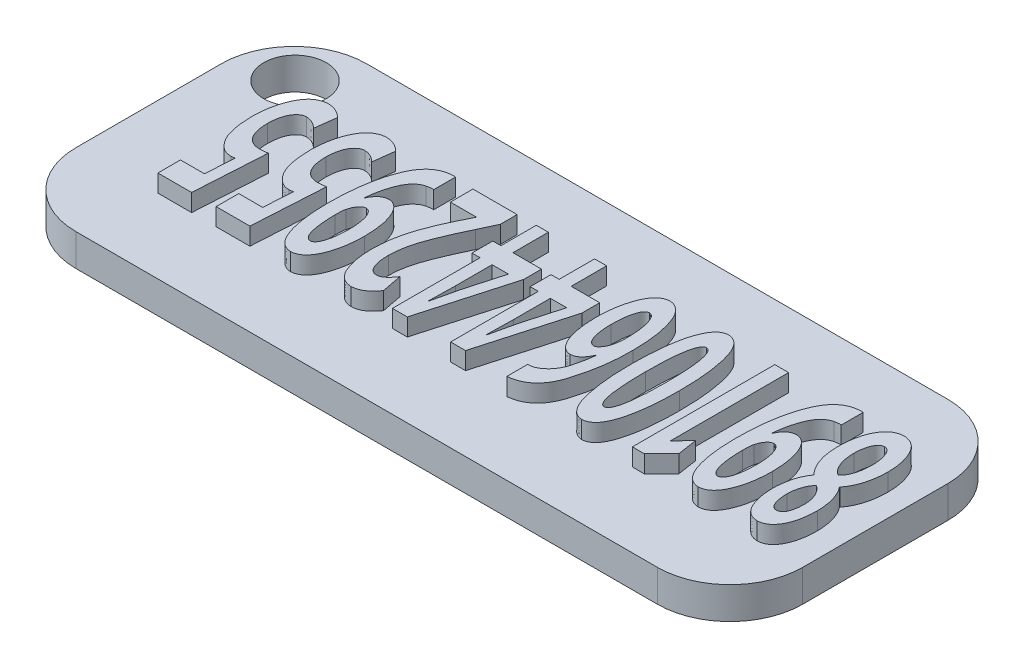
from build123d import *

# Parameters (mm, degrees)
SKETCH_1_W          = 50
SKETCH_1_H          = 20
EXTRUDE_1_DEPTH     = 2.2
FILLET_1_R          = 5
FILLET_2_R          = 5
FILLET_3_R          = 5
FILLET_4_R          = 5
SKETCH_4_R          = 2.151855383
CUT_EXTRUDE_1_DEPTH = 3
EXTRUDE_START       = -1.2
EXTRUDE_1058_DEPTH  = 1.2


# Read off the part's stored shape, not the designer's step: надпись
with BuildPart() as part:
    # Эскиз1 → Бобышка-Вытянуть1 (new body)
    with BuildSketch(Plane(origin=(0, 0, 0), x_dir=(1, 0, 0), z_dir=(0, 1, 0))):
        with Locations((25, 10)):
            Rectangle(SKETCH_1_W, SKETCH_1_H)
    extrude(amount=EXTRUDE_1_DEPTH)

    # Скругление1
    fillet_1_edges = [part.edges().sort_by_distance(p)[0] for p in [
        (0, 1.1, -20),
    ]]
    fillet(fillet_1_edges, radius=FILLET_1_R)

    # Скругление2
    fillet_2_edges = [part.edges().sort_by_distance(p)[0] for p in [
        (0, 1.1, 0),
    ]]
    fillet(fillet_2_edges, radius=FILLET_2_R)

    # Скругление3
    fillet_3_edges = [part.edges().sort_by_distance(p)[0] for p in [
        (50, 1.1, -20),
    ]]
    fillet(fillet_3_edges, radius=FILLET_3_R)

    # Скругление4
    fillet_4_edges = [part.edges().sort_by_distance(p)[0] for p in [
        (50, 1.1, 0),
    ]]
    fillet(fillet_4_edges, radius=FILLET_4_R)

    # Эскиз4 → Вырез-Вытянуть1 (cut)
    with BuildSketch(Plane(origin=(0, 2.2, 0), x_dir=(1, 0, 0), z_dir=(0, 1, 0))):
        with Locations(Location((3.542470198, 16.528352227, 0), (0, 0, 270))):
            Circle(SKETCH_4_R)
    extrude(amount=-CUT_EXTRUDE_1_DEPTH, mode=Mode.SUBTRACT)

    # Extrude 1058 outline → Extrude 1058 (add)
    # profile 1 of 11: a face of its own
    with BuildSketch(Plane.XZ.offset(-2.2).offset(EXTRUDE_START)):
        with BuildLine():
            add(Edge.make_bspline(
                [(46.078309947, -9.677843866), (46.027974113, -9.605172508), (45.925734825, -9.457566573), (45.797719515, -9.21403545), (45.690766361, -8.949790128), (45.605330166, -8.667262078), (45.538818282, -8.374682095), (45.489532793, -8.076942657), (45.45786786, -7.777208198), (45.454564992, -7.576119586), (45.452912137, -7.475488811)],
                knots=[0, 0, 0, 0, 0.113941103, 0.2314307, 0.353960198, 0.481139313, 0.611706454, 0.740704099, 0.870240551, 1, 1, 1, 1], degree=3))
            Line((46.078309947, -9.677843866), (46.078854937, -9.703996008))
            add(Edge.make_bspline(
                [(45.211584793, -12.207767208), (45.21631399, -12.061200702), (45.225433942, -11.778556663), (45.273766155, -11.372768263), (45.352120596, -11.002667897), (45.459635252, -10.669550107), (45.589719445, -10.373513923), (45.734618791, -10.113421233), (45.894005329, -9.888382936), (46.01865144, -9.764048816), (46.078854937, -9.703996008)],
                knots=[0, 0, 0, 0, 0.161686258, 0.311801503, 0.450067459, 0.578302134, 0.697174596, 0.806108895, 0.906351489, 1, 1, 1, 1], degree=3))
            add(Edge.make_bspline(
                [(46.863168807, -15.113122193), (46.80262288, -15.109171079), (46.684044908, -15.101432903), (46.511067483, -15.060678112), (46.347933835, -14.995360647), (46.191896755, -14.909032346), (46.047301537, -14.794897335), (45.911617757, -14.658556004), (45.784541788, -14.498597289), (45.668579213, -14.315558168), (45.563753042, -14.112223731), (45.470997983, -13.891170782), (45.394091896, -13.651866208), (45.330756558, -13.395988548), (45.279593831, -13.122797621), (45.242938773, -12.833195306), (45.217255905, -12.526213109), (45.213510802, -12.315917003), (45.211584793, -12.207767208)],
                knots=[0, 0, 0, 0, 0.04935732, 0.096665312, 0.144003759, 0.192132698, 0.241383724, 0.293506514, 0.348508342, 0.407438452, 0.469713062, 0.534644972, 0.602472394, 0.674232576, 0.749229871, 0.828723586, 0.911917015, 1, 1, 1, 1], degree=3))
            add(Edge.make_bspline(
                [(48.454420985, -12.428355484), (48.452674256, -12.516993812), (48.449226519, -12.691950305), (48.430923326, -12.949468758), (48.398000408, -13.197850059), (48.355874941, -13.436766086), (48.298960072, -13.665970943), (48.22900655, -13.885768002), (48.146139953, -14.095954879), (48.053448211, -14.295680741), (47.946991827, -14.478130498), (47.827908731, -14.639709615), (47.697781171, -14.778860945), (47.554387512, -14.893967333), (47.398514091, -14.984872048), (47.231251794, -15.053623861), (47.051286399, -15.097807415), (46.926883157, -15.107935165), (46.863168807, -15.113122193)],
                knots=[0, 0, 0, 0, 0.077214743, 0.152408342, 0.224719305, 0.295370231, 0.363611314, 0.430261871, 0.496132333, 0.560288229, 0.621875218, 0.679791288, 0.734777273, 0.787353525, 0.839365363, 0.891411757, 0.944385459, 1, 1, 1, 1], degree=3))
            add(Edge.make_bspline(
                [(47.695145343, -9.85936227), (47.747554237, -9.926459085), (47.856031089, -10.065337253), (47.992318934, -10.306361212), (48.120543883, -10.577558027), (48.235291236, -10.883599416), (48.332007715, -11.222904393), (48.400135986, -11.596003837), (48.444033938, -12.001236193), (48.450872319, -12.282433004), (48.454420985, -12.428355484)],
                knots=[0, 0, 0, 0, 0.093486626, 0.193500263, 0.303527542, 0.423128014, 0.552388557, 0.690879033, 0.839586736, 1, 1, 1, 1], degree=3))
            Line((47.695145343, -9.85936227), (47.696502294, -9.820888941))
            add(Edge.make_bspline(
                [(48.333757313, -7.669681908), (48.332400882, -7.773485108), (48.329714157, -7.979091408), (48.294470298, -8.282880004), (48.248183965, -8.579721921), (48.175551215, -8.86483122), (48.087174996, -9.135586497), (47.976756913, -9.385857701), (47.850277624, -9.616246555), (47.747160445, -9.753473674), (47.696502294, -9.820888941)],
                knots=[0, 0, 0, 0, 0.136247325, 0.26986941, 0.401216199, 0.530532356, 0.655813574, 0.774814705, 0.889373711, 1, 1, 1, 1], degree=3))
            add(Edge.make_bspline(
                [(46.853741958, -5.003768899), (46.90797993, -5.007260305), (47.014463515, -5.014114866), (47.169787234, -5.050784431), (47.315929588, -5.110360712), (47.455258419, -5.189599), (47.583778459, -5.293674812), (47.705715522, -5.417268753), (47.817999658, -5.563759963), (47.924291395, -5.729516874), (48.016616167, -5.916192509), (48.100737096, -6.118543686), (48.169034399, -6.33794704), (48.228390088, -6.572481678), (48.272394452, -6.824061429), (48.306605506, -7.091379936), (48.326940882, -7.375267295), (48.331443098, -7.569726588), (48.333757313, -7.669681908)],
                knots=[0, 0, 0, 0, 0.048503693, 0.095225668, 0.141839522, 0.189135082, 0.237898156, 0.289124475, 0.343943217, 0.402519234, 0.464803107, 0.529773363, 0.598149215, 0.669927247, 0.745822609, 0.826203937, 0.910665924, 1, 1, 1, 1], degree=3))
            add(Edge.make_bspline(
                [(45.452912137, -7.475488811), (45.456739433, -7.319432744), (45.464194853, -7.015441717), (45.526511786, -6.573878797), (45.63311746, -6.161319712), (45.753938359, -5.83962289), (45.873267915, -5.604845892), (45.977498211, -5.452969286), (46.093544961, -5.323103196), (46.221115754, -5.213766333), (46.361470193, -5.126354365), (46.514657083, -5.061353085), (46.680172404, -5.019646003), (46.795068916, -5.009135957), (46.853741958, -5.003768899)],
                knots=[0, 0, 0, 0, 0.14929621, 0.290823096, 0.425604597, 0.556392853, 0.618800505, 0.677186811, 0.732126157, 0.785029691, 0.837431757, 0.889709436, 0.943679032, 1, 1, 1, 1], degree=3))
        make_face()
        with BuildLine():
            add(Edge.make_bspline(
                [(46.161811212, -12.362367538), (46.163759344, -12.457382745), (46.167514338, -12.640523049), (46.202428312, -12.9042703), (46.256201504, -13.146406235), (46.3292193, -13.363319376), (46.421100573, -13.54734881), (46.538282039, -13.686539035), (46.679667922, -13.777266891), (46.784568197, -13.793060782), (46.836544836, -13.80087038)],
                knots=[0, 0, 0, 0, 0.165153543, 0.318330835, 0.461763472, 0.595861741, 0.715629486, 0.817101713, 0.909318156, 0.99986714, 0.99986714, 0.99986714, 0.99986714], degree=3))
            add(Edge.make_bspline(
                [(46.914073794, -10.509048947), (46.86044007, -10.548203883), (46.750645538, -10.628358636), (46.609486585, -10.785243872), (46.482183681, -10.970250236), (46.371339819, -11.186804007), (46.277961057, -11.434662914), (46.214225457, -11.716286991), (46.172416068, -12.028695365), (46.165451114, -12.247841318), (46.161811212, -12.362367538)],
                knots=[0, 0, 0, 0, 0.095604842, 0.195714339, 0.302624958, 0.419033209, 0.545871774, 0.683790463, 0.83474811, 1, 1, 1, 1], degree=3))
            add(Edge.make_bspline(
                [(47.504194566, -12.245474606), (47.501605234, -12.149267424), (47.496550758, -11.961467335), (47.469393374, -11.687559734), (47.419429409, -11.430678791), (47.355280098, -11.191444527), (47.271814748, -10.975113826), (47.170826099, -10.787544871), (47.053714874, -10.629827493), (46.959591571, -10.548418242), (46.914073794, -10.509048947)],
                knots=[0, 0, 0, 0, 0.152677995, 0.29803327, 0.436098728, 0.567455095, 0.690591438, 0.803037348, 0.90474939, 1, 1, 1, 1], degree=3))
            add(Edge.make_bspline(
                [(46.836544836, -13.80087038), (46.86261082, -13.798162612), (46.913863854, -13.792811886), (46.987088364, -13.766571208), (47.056547102, -13.729238508), (47.117966898, -13.673680896), (47.180206287, -13.610280654), (47.232947149, -13.529565327), (47.285573124, -13.438614817), (47.344553499, -13.294330749), (47.410925257, -13.095175517), (47.463520234, -12.833038866), (47.498548764, -12.547453652), (47.502265453, -12.348657789), (47.504194566, -12.245474606)],
                knots=[0.000181514, 0.000181514, 0.000181514, 0.000181514, 0.043073183, 0.084527609, 0.127035215, 0.1717059, 0.219898678, 0.272580112, 0.329424805, 0.392311346, 0.528096431, 0.673647876, 0.8306099, 1, 1, 1, 1], degree=3))
        make_face(mode=Mode.SUBTRACT)
        with BuildLine():
            add(Edge.make_bspline(
                [(47.504194566, -7.579184154), (47.503195757, -7.499277873), (47.501255068, -7.344019773), (47.473234473, -7.117775601), (47.431519103, -6.903753043), (47.369090488, -6.707727668), (47.290569229, -6.53547269), (47.182295761, -6.403004689), (47.043184988, -6.318466445), (46.940284878, -6.303102084), (46.887678615, -6.295247266)],
                knots=[0, 0, 0, 0, 0.153851589, 0.298934016, 0.438563176, 0.573351932, 0.694652626, 0.801164328, 0.898348004, 1, 1, 1, 1], degree=3))
            add(Edge.make_bspline(
                [(46.81226382, -9.134614305), (46.862439152, -9.096350175), (46.963589503, -9.019212066), (47.096313583, -8.876918569), (47.213065342, -8.713564267), (47.315895318, -8.52958974), (47.398878962, -8.323302575), (47.458545593, -8.094677067), (47.497098, -7.844424879), (47.501769248, -7.669832657), (47.504194566, -7.579184154)],
                knots=[0, 0, 0, 0, 0.106825906, 0.215354388, 0.328311063, 0.44659403, 0.571831886, 0.704152423, 0.846395563, 1, 1, 1, 1], degree=3))
            add(Edge.make_bspline(
                [(46.282474884, -7.64328673), (46.285542594, -7.725718472), (46.291533991, -7.886711995), (46.322755467, -8.121747951), (46.368092179, -8.344452345), (46.434989814, -8.55067455), (46.511234044, -8.737323134), (46.60109943, -8.897440638), (46.696643827, -9.032946341), (46.775094048, -9.101929862), (46.81226382, -9.134614305)],
                knots=[0, 0, 0, 0, 0.152064887, 0.296990713, 0.436806136, 0.570611067, 0.696334438, 0.80790798, 0.908986661, 1, 1, 1, 1], degree=3))
            add(Edge.make_bspline(
                [(46.886500259, -6.293647279), (46.83538083, -6.301938363), (46.734376801, -6.318320253), (46.600140532, -6.408312885), (46.493740845, -6.543789202), (46.41679896, -6.722317663), (46.358261152, -6.92709015), (46.311903706, -7.152013712), (46.285864996, -7.392535246), (46.283622758, -7.558383626), (46.282474884, -7.64328673)],
                knots=[0, 0, 0, 0, 0.095691051, 0.189070611, 0.29330398, 0.413483092, 0.549311339, 0.690551989, 0.841583641, 1, 1, 1, 1], degree=3))
            Line((46.886500259, -6.293647279), (46.887678615, -6.295247266))
        make_face(mode=Mode.SUBTRACT)
    # profile 2 of 11: a face of its own
    with BuildSketch(Plane.XZ.offset(-2.2).offset(EXTRUDE_START)):
        with BuildLine():
            add(Edge.make_bspline(
                [(44.04725437, -15.11174683), (43.987385205, -15.114070393), (43.868898808, -15.118668932), (43.693434551, -15.103937408), (43.523252435, -15.077828695), (43.358741609, -15.039003764), (43.201388033, -14.983318238), (43.050111553, -14.915129471), (42.903936107, -14.834674512), (42.766996185, -14.736787277), (42.632629914, -14.629426485), (42.508059907, -14.504726533), (42.38788946, -14.367318384), (42.273368197, -14.217136563), (42.16508345, -14.052358087), (42.066568067, -13.872002181), (41.96939987, -13.68052939), (41.851289199, -13.402249017), (41.717343953, -13.031760823), (41.577455337, -12.561667209), (41.462107324, -12.061386408), (41.365507994, -11.533031322), (41.293318956, -10.975995836), (41.240314731, -10.390514117), (41.210397464, -9.775330417), (41.207191415, -9.35523444), (41.205550872, -9.140270414)],
                knots=[0, 0, 0, 0, 0.024487623, 0.048463181, 0.07187814, 0.09488595, 0.117488049, 0.140040387, 0.162712552, 0.185605178, 0.208811761, 0.232989069, 0.257583726, 0.28344624, 0.310184461, 0.338150104, 0.367466745, 0.397981826, 0.461741489, 0.528520028, 0.598484453, 0.671649595, 0.748146436, 0.828163951, 0.91207112, 1, 1, 1, 1], degree=3))
            Line((44.04725437, -15.11174683), (44.048688651, -13.601055549))
            add(Edge.make_bspline(
                [(43.579231551, -13.561462782), (43.61258245, -13.566861786), (43.67367764, -13.576752169), (43.756732427, -13.593836438), (43.824452891, -13.601489775), (43.891708091, -13.613413366), (43.965642464, -13.61504435), (44.021131507, -13.605697441), (44.048688651, -13.601055549)],
                knots=[0, 0, 0, 0, 0.213719524, 0.39151073, 0.53600369, 0.644514602, 0.823457719, 1, 1, 1, 1], degree=3))
            add(Edge.make_bspline(
                [(42.143203863, -10.732850085), (42.152913081, -10.826145832), (42.171961613, -11.009182943), (42.213021068, -11.276889607), (42.256329034, -11.533427069), (42.312327657, -11.777714281), (42.373431464, -12.010753199), (42.443989973, -12.232601603), (42.520328195, -12.443143418), (42.604992277, -12.640929958), (42.696024941, -12.824197987), (42.797560211, -12.98838531), (42.907535712, -13.132919259), (43.024857499, -13.258958894), (43.151200313, -13.365300223), (43.286637025, -13.450625789), (43.428878747, -13.518420365), (43.529094466, -13.547109732), (43.579231551, -13.561462782)],
                knots=[0, 0, 0, 0, 0.083749371, 0.164308055, 0.241812066, 0.316015091, 0.388027431, 0.456894199, 0.523829033, 0.58793985, 0.648928779, 0.706394687, 0.760048322, 0.810868126, 0.859873756, 0.907048861, 0.953497323, 1, 1, 1, 1], degree=3))
            Line((42.143203863, -10.732850085), (42.163318771, -10.720210373))
            add(Edge.make_bspline(
                [(43.094691492, -11.489441284), (43.044787182, -11.486183321), (42.945933546, -11.479729739), (42.803226891, -11.439100379), (42.670705849, -11.373559165), (42.548260623, -11.283451948), (42.439085027, -11.168339541), (42.333351592, -11.038338918), (42.241947327, -10.886319281), (42.190018525, -10.776615668), (42.163318771, -10.720210373)],
                knots=[0, 0, 0, 0, 0.116925784, 0.23161404, 0.344884987, 0.461810772, 0.58572325, 0.71565789, 0.85380244, 1, 1, 1, 1], degree=3))
            add(Edge.make_bspline(
                [(44.446501695, -8.465307997), (44.444301581, -8.579725962), (44.440018776, -8.802455229), (44.418138685, -9.126841338), (44.389744776, -9.432845618), (44.346232134, -9.719112434), (44.291514129, -9.986576149), (44.226515668, -10.234971415), (44.149036141, -10.464286834), (44.061521886, -10.673296099), (43.963022591, -10.859813171), (43.86081538, -11.024451663), (43.750302846, -11.165118524), (43.632325733, -11.27981019), (43.50792487, -11.371672429), (43.375998762, -11.435440305), (43.238321206, -11.480471442), (43.142806007, -11.486436477), (43.094691492, -11.489441284)],
                knots=[0, 0, 0, 0, 0.095610673, 0.186118458, 0.27160428, 0.352333468, 0.42792741, 0.499640582, 0.56673059, 0.630030627, 0.688754273, 0.74280495, 0.791766595, 0.837817092, 0.879939355, 0.920333827, 0.959869222, 1, 1, 1, 1], degree=3))
            add(Edge.make_bspline(
                [(42.81188601, -4.994342049), (42.873943174, -5.000099892), (42.997342197, -5.011549209), (43.174435585, -5.071753842), (43.341841896, -5.156147597), (43.497681637, -5.27312241), (43.642287555, -5.41903082), (43.776639778, -5.595135643), (43.901300582, -5.799757373), (44.011533243, -6.03278609), (44.113476948, -6.28555358), (44.198583084, -6.556030295), (44.274785722, -6.839444532), (44.337084136, -7.137093239), (44.382818759, -7.449561619), (44.419726254, -7.775163248), (44.439445614, -8.115654083), (44.444116993, -8.347137517), (44.446501695, -8.465307997)],
                knots=[0, 0, 0, 0, 0.044788294, 0.089060333, 0.133839461, 0.179508177, 0.228843309, 0.281493248, 0.338836435, 0.401246252, 0.467120147, 0.535176432, 0.605509425, 0.678636709, 0.754243913, 0.833093643, 0.914795611, 1, 1, 1, 1], degree=3))
            add(Edge.make_bspline(
                [(41.205550872, -9.140270414), (41.207264897, -8.991309733), (41.210614758, -8.700183418), (41.228928778, -8.27442403), (41.26139615, -7.870179001), (41.303851059, -7.487012124), (41.35985007, -7.12516581), (41.429753321, -6.785560877), (41.510350616, -6.467461477), (41.603134364, -6.172814895), (41.708826173, -5.906123561), (41.827749924, -5.671195277), (41.958955197, -5.470530026), (42.102547312, -5.302101472), (42.26283362, -5.173038944), (42.433532632, -5.075831142), (42.618009403, -5.01296775), (42.746684608, -5.000605939), (42.81188601, -4.994342049)],
                knots=[0, 0, 0, 0, 0.093043437, 0.181842568, 0.266109144, 0.34630305, 0.422583728, 0.494716837, 0.562788119, 0.627465506, 0.6875281, 0.741774322, 0.791636758, 0.836982325, 0.879404895, 0.919475901, 0.959197391, 1, 1, 1, 1], degree=3))
        make_face()
        with BuildLine():
            add(Edge.make_bspline(
                [(43.501931386, -8.291853969), (43.499172297, -8.153522521), (43.493908565, -7.889616713), (43.460775977, -7.513375446), (43.405536667, -7.177101272), (43.340129957, -6.924955276), (43.279157951, -6.746836863), (43.227842301, -6.634724435), (43.176350338, -6.536377609), (43.117340877, -6.457508469), (43.056964627, -6.392355076), (42.99033886, -6.347000991), (42.91982955, -6.316280085), (42.870621648, -6.309816763), (42.845822668, -6.306559485)],
                knots=[0, 0, 0, 0, 0.187002657, 0.356759712, 0.510118111, 0.647153892, 0.708418131, 0.764316503, 0.813745831, 0.85809532, 0.897148384, 0.933203113, 0.966336816, 1, 1, 1, 1], degree=3))
            add(Edge.make_bspline(
                [(42.832625079, -10.186650697), (42.857327254, -10.184568066), (42.906667609, -10.1804082), (42.978465354, -10.154699735), (43.044277372, -10.112341419), (43.106396021, -10.054870548), (43.165721311, -9.984224083), (43.221107135, -9.897287482), (43.271162554, -9.795137333), (43.33631677, -9.632755834), (43.402506594, -9.394999705), (43.459803499, -9.070602549), (43.494534602, -8.697313717), (43.499373301, -8.432077134), (43.501931386, -8.291853969)],
                knots=[0, 0, 0, 0, 0.03448244, 0.068875547, 0.105130244, 0.143003502, 0.186571321, 0.233520861, 0.286467941, 0.345095043, 0.477485255, 0.629894425, 0.804335531, 1, 1, 1, 1], degree=3))
            add(Edge.make_bspline(
                [(42.208567648, -9.430617376), (42.238302449, -9.525684566), (42.295931093, -9.709933092), (42.4157911, -9.915830309), (42.528538944, -10.050337156), (42.621005158, -10.125337554), (42.723563966, -10.173398169), (42.796336215, -10.182241067), (42.832625079, -10.186650697)],
                knots=[0, 0, 0, 0, 0.286215616, 0.554710882, 0.6791684, 0.78996751, 0.895264466, 1, 1, 1, 1], degree=3))
            add(Edge.make_bspline(
                [(42.155777292, -8.702864602), (42.155368544, -8.74812072), (42.154596287, -8.833624136), (42.15968612, -8.954239716), (42.162435199, -9.060539025), (42.170279424, -9.177455748), (42.179085395, -9.300512339), (42.199485933, -9.390539813), (42.208567648, -9.430617376)],
                knots=[0, 0, 0, 0, 0.185634103, 0.350722746, 0.495196877, 0.621767754, 0.831622217, 1, 1, 1, 1], degree=3))
            add(Edge.make_bspline(
                [(42.844590917, -6.304677798), (42.81632972, -6.308919917), (42.759015095, -6.317523072), (42.678836933, -6.357293238), (42.605990003, -6.416423603), (42.536602226, -6.493216758), (42.476050485, -6.592472346), (42.419178939, -6.710531156), (42.368846462, -6.849011498), (42.308227289, -7.066665145), (42.244553984, -7.373100249), (42.194071408, -7.777220869), (42.161821034, -8.225345058), (42.15785408, -8.538776352), (42.155777292, -8.702864602)],
                knots=[0, 0, 0, 0, 0.032360413, 0.065627968, 0.100251475, 0.138736479, 0.182780166, 0.232036785, 0.287698539, 0.350174283, 0.489029732, 0.64337453, 0.813298638, 1, 1, 1, 1], degree=3))
            Line((42.844590917, -6.304677798), (42.845822668, -6.306559485))
        make_face(mode=Mode.SUBTRACT)
    # profile 3 of 11: a face of its own
    with BuildSketch(Plane.XZ.offset(-2.2).offset(EXTRUDE_START)):
        with BuildLine():
            add(Edge.make_bspline(
                [(34.821367358, -15.101809973), (34.758371034, -15.09638161), (34.631985738, -15.085491049), (34.449405767, -15.01868558), (34.28025536, -14.908811333), (34.122442761, -14.759422894), (33.980242568, -14.566701686), (33.845874104, -14.33684957), (33.724835618, -14.065712383), (33.614862883, -13.755863084), (33.514803262, -13.409193068), (33.432270523, -13.025732465), (33.358172661, -12.608293788), (33.298933813, -12.15591364), (33.25204862, -11.66856733), (33.218888626, -11.146674152), (33.197866733, -10.589663148), (33.194974053, -10.206781024), (33.193483032, -10.009425929)],
                knots=[0, 0, 0, 0, 0.033109461, 0.06642529, 0.100865822, 0.138473422, 0.179945314, 0.226267604, 0.2781327, 0.335680383, 0.398904279, 0.467558637, 0.541656706, 0.621602041, 0.707188389, 0.798842127, 0.89631396, 1, 1, 1, 1], degree=3))
            Line((34.821367358, -15.101809973), (34.822442608, -15.101809973))
            add(Edge.make_bspline(
                [(36.436319225, -10.086726094), (36.436083751, -10.25831122), (36.435622164, -10.594660491), (36.417659208, -11.088138692), (36.390245954, -11.560997764), (36.349298648, -12.012552367), (36.294094971, -12.443776648), (36.228810149, -12.853881675), (36.151934451, -13.243461663), (36.062823732, -13.608118868), (35.962538815, -13.942186433), (35.843466511, -14.236088467), (35.713149094, -14.489470684), (35.566009461, -14.700168368), (35.40286528, -14.867821763), (35.223889879, -14.991663615), (35.029518106, -15.075757432), (34.891730566, -15.093092731), (34.822442608, -15.101809973)],
                knots=[0, 0, 0, 0, 0.091547972, 0.179456661, 0.263440314, 0.344257307, 0.421328872, 0.495367316, 0.565800515, 0.633142072, 0.695615521, 0.751721211, 0.802120328, 0.847339139, 0.888360757, 0.926217596, 0.962897719, 1, 1, 1, 1], degree=3))
            add(Edge.make_bspline(
                [(34.79039132, -5.005654268), (34.857736276, -5.012484701), (34.991926218, -5.026094857), (35.182790125, -5.105203556), (35.360628892, -5.221532839), (35.522537416, -5.383463747), (35.671462474, -5.584916244), (35.803880809, -5.829877383), (35.926696152, -6.114231056), (36.033529463, -6.439779921), (36.128218001, -6.799585126), (36.210068103, -7.188714477), (36.282880803, -7.604092372), (36.337426869, -8.047913084), (36.383192211, -8.5187241), (36.41450535, -9.017369504), (36.433689263, -9.54295639), (36.435428552, -9.902570919), (36.436319225, -10.086726094)],
                knots=[0, 0, 0, 0, 0.035432365, 0.07060168, 0.107362668, 0.146629638, 0.190325044, 0.238704697, 0.292737959, 0.353046496, 0.418707631, 0.488331289, 0.562123203, 0.640426583, 0.723437346, 0.810876272, 0.903151541, 1, 1, 1, 1], degree=3))
            add(Edge.make_bspline(
                [(33.193483032, -10.009425929), (33.193662643, -9.83846625), (33.194014697, -9.503367638), (33.212780558, -9.011224948), (33.237450067, -8.539569403), (33.276986168, -8.08868405), (33.329736307, -7.659276576), (33.393699665, -7.250492679), (33.469164864, -6.862499825), (33.553004984, -6.497128173), (33.653235104, -6.164136588), (33.766206659, -5.869060173), (33.898439487, -5.617603335), (34.045022424, -5.408078929), (34.206395895, -5.238370761), (34.386881045, -5.116430621), (34.581925939, -5.031316429), (34.720434049, -5.014266033), (34.79039132, -5.005654268)],
                knots=[0, 0, 0, 0, 0.091423284, 0.17919907, 0.263357202, 0.343996012, 0.421203867, 0.494696639, 0.565227649, 0.632567207, 0.695086524, 0.751072127, 0.801290447, 0.84661368, 0.887494442, 0.925716055, 0.962480882, 1, 1, 1, 1], degree=3))
        make_face()
        with BuildLine():
            add(Edge.make_bspline(
                [(34.143709452, -10.047133326), (34.143696262, -10.186029654), (34.143670654, -10.455688364), (34.154171592, -10.847230506), (34.167314759, -11.21300133), (34.182722741, -11.553232374), (34.20827292, -11.867383211), (34.235658748, -12.156693129), (34.268989574, -12.42027127), (34.308869853, -12.657820879), (34.35082763, -12.869029514), (34.399385347, -13.052446275), (34.452874668, -13.208257337), (34.513469621, -13.335639631), (34.576158734, -13.438174671), (34.646521288, -13.51262204), (34.724891483, -13.561383273), (34.781632901, -13.567777839), (34.809245019, -13.570889631)],
                knots=[0, 0, 0, 0, 0.111876346, 0.21720107, 0.315472169, 0.406706071, 0.491501006, 0.5693244, 0.640778939, 0.705442812, 0.7633229, 0.814159852, 0.858189582, 0.895776399, 0.92765235, 0.954501245, 0.977858908, 1, 1, 1, 1], degree=3))
            add(Edge.make_bspline(
                [(34.803588909, -6.536574611), (34.775349389, -6.540357152), (34.717237466, -6.548140951), (34.637126243, -6.598099153), (34.567023079, -6.675722822), (34.501239539, -6.779129337), (34.442060326, -6.910851832), (34.387510611, -7.069801856), (34.342295482, -7.257708958), (34.298947128, -7.47144033), (34.261919185, -7.711195986), (34.229992411, -7.975298625), (34.204678533, -8.263370431), (34.181392167, -8.574425254), (34.165444037, -8.908908887), (34.151730619, -9.267121362), (34.144354019, -9.649288884), (34.143928368, -9.91201243), (34.143709452, -10.047133326)],
                knots=[0, 0, 0, 0, 0.02282151, 0.046962619, 0.074280081, 0.106979802, 0.145629234, 0.190785966, 0.242671978, 0.301768248, 0.367098558, 0.43876204, 0.516833704, 0.600899803, 0.690958447, 0.787572338, 0.890746694, 1, 1, 1, 1], degree=3))
            add(Edge.make_bspline(
                [(35.486092806, -10.047133326), (35.484715324, -9.905720785), (35.482051781, -9.632281081), (35.469922157, -9.235723213), (35.45576461, -8.866717887), (35.43532769, -8.524723037), (35.408423361, -8.209903763), (35.379654557, -7.921739256), (35.343089475, -7.661002482), (35.305123286, -7.427248661), (35.259455182, -7.22174442), (35.211927628, -7.04199042), (35.155548607, -6.891224861), (35.097988377, -6.764364414), (35.032500307, -6.666759457), (34.964407075, -6.591936222), (34.886011838, -6.546845111), (34.83045665, -6.539922528), (34.803588909, -6.536574611)],
                knots=[0, 0, 0, 0, 0.114262027, 0.220940622, 0.320549566, 0.412628422, 0.497726161, 0.575841092, 0.646576625, 0.710438676, 0.767113155, 0.81663727, 0.86049835, 0.897066001, 0.928894915, 0.95510868, 0.978289546, 1, 1, 1, 1], degree=3))
            add(Edge.make_bspline(
                [(34.814851417, -13.570889631), (34.84179605, -13.566913579), (34.897667546, -13.55866897), (34.975825148, -13.510949639), (35.045484749, -13.436461328), (35.109457139, -13.335455549), (35.168850888, -13.208647312), (35.222839264, -13.054997071), (35.270977013, -12.874474472), (35.315996973, -12.66755349), (35.355116852, -12.433448541), (35.388014353, -12.172314412), (35.419350349, -11.884590633), (35.439289677, -11.569314118), (35.462401311, -11.22763153), (35.473317874, -10.858511079), (35.483954562, -10.461974123), (35.485363916, -10.188545351), (35.486092806, -10.047133326)],
                knots=[0, 0, 0, 0, 0.021768481, 0.045138398, 0.072001378, 0.103468932, 0.141075468, 0.184651119, 0.234536993, 0.291561357, 0.355260178, 0.425747615, 0.503662887, 0.588464502, 0.680308007, 0.779642985, 0.886035652, 1, 1, 1, 1], degree=3))
            Line((34.814851417, -13.570889631), (34.809245019, -13.570889631))
        make_face(mode=Mode.SUBTRACT)
    # profile 4 of 11: a face of its own
    with BuildSketch(Plane.XZ.offset(-2.2).offset(EXTRUDE_START)):
        with BuildLine():
            add(Edge.make_bspline(
                [(29.646479601, -4.99245852), (29.714854487, -5.000842151), (29.849569548, -5.017359931), (30.046357879, -5.059843138), (30.235431453, -5.113430065), (30.414805813, -5.183948537), (30.586066327, -5.267130332), (30.748052786, -5.365256171), (30.901348079, -5.477562867), (31.047642011, -5.601709045), (31.182858857, -5.742653389), (31.312170934, -5.895297946), (31.43037466, -6.063686791), (31.540253734, -6.245932206), (31.641438312, -6.442156459), (31.735925744, -6.651435488), (31.821248495, -6.874836651), (31.918983889, -7.19079218), (32.029035775, -7.593351611), (32.143724183, -8.076997935), (32.241223497, -8.556502389), (32.315260029, -9.032364407), (32.375465973, -9.503692343), (32.412123221, -9.971800935), (32.432408989, -10.435967264), (32.429732276, -10.744074101), (32.428399935, -10.897435142)],
                knots=[0, 0, 0, 0, 0.028917775, 0.056975011, 0.084456505, 0.111365472, 0.137806966, 0.164332636, 0.190782033, 0.217549533, 0.244800648, 0.27271475, 0.301495134, 0.331098834, 0.36202831, 0.394160803, 0.427493649, 0.462385715, 0.533013785, 0.602731, 0.671109872, 0.738455515, 0.804945942, 0.87061564, 0.935598573, 1, 1, 1, 1], degree=3))
            Line((29.646479601, -4.99245852), (29.647479363, -6.427223158))
            add(Edge.make_bspline(
                [(30.066031476, -6.493211103), (29.991643675, -6.474254325), (29.854113992, -6.439206647), (29.71249754, -6.430993797), (29.647479363, -6.427223158)],
                knots=[0, 0, 0, 0, 0.540885423, 1, 1, 1, 1], degree=3))
            add(Edge.make_bspline(
                [(31.451778338, -9.345775731), (31.455501121, -9.328869498), (31.465189239, -9.284872963), (31.46127673, -9.200794399), (31.450084615, -9.086412778), (31.42525671, -8.940923647), (31.396310695, -8.763299028), (31.35427448, -8.554652248), (31.300186469, -8.314993926), (31.242192322, -8.051435064), (31.169560452, -7.782270601), (31.071450881, -7.528948463), (30.953413328, -7.298678136), (30.818615228, -7.089418275), (30.659619621, -6.904801036), (30.482336213, -6.742113431), (30.284288492, -6.601769278), (30.139368555, -6.529688004), (30.066031476, -6.493211103)],
                knots=[0, 0, 0, 0, 0.015495237, 0.04032458, 0.074913193, 0.118889038, 0.172696469, 0.236552562, 0.309940194, 0.39330633, 0.478881574, 0.559992191, 0.636714608, 0.710902782, 0.782943777, 0.854838757, 0.926540807, 1, 1, 1, 1], degree=3))
            add(Edge.make_bspline(
                [(30.512864138, -8.493588546), (30.562817581, -8.497322668), (30.66145597, -8.50469609), (30.805042367, -8.549788955), (30.938611951, -8.625518892), (31.062344581, -8.728082661), (31.175667862, -8.854281448), (31.27876982, -9.000407958), (31.374097446, -9.164632945), (31.425375007, -9.284206241), (31.451778338, -9.345775731)],
                knots=[0, 0, 0, 0, 0.111502154, 0.220172867, 0.332544669, 0.452131387, 0.577215859, 0.709913914, 0.850631761, 1, 1, 1, 1], degree=3))
            add(Edge.make_bspline(
                [(29.191219852, -11.585595148), (29.193746577, -11.466174094), (29.198669904, -11.233482061), (29.216045951, -10.894931228), (29.249238429, -10.57752642), (29.289235957, -10.281564087), (29.342367125, -10.006573748), (29.405395921, -9.75253814), (29.480763963, -9.51931701), (29.567070092, -9.308137608), (29.662190387, -9.120061212), (29.765020833, -8.95645015), (29.871023756, -8.81503011), (29.98724182, -8.700812235), (30.108711331, -8.610306244), (30.237202227, -8.544707545), (30.372760011, -8.503405447), (30.466080916, -8.496866581), (30.512864138, -8.493588546)],
                knots=[0, 0, 0, 0, 0.098437326, 0.19180522, 0.279258748, 0.361365344, 0.437849901, 0.509951347, 0.5769384, 0.639646388, 0.69778416, 0.750377086, 0.798754049, 0.843068062, 0.884192353, 0.923104738, 0.961451209, 1, 1, 1, 1], degree=3))
            add(Edge.make_bspline(
                [(30.756076852, -15.101809973), (30.696552357, -15.095226544), (30.578202764, -15.082137038), (30.407903068, -15.022831398), (30.246791601, -14.934995789), (30.097869801, -14.81418327), (29.959004863, -14.664625538), (29.83039217, -14.485152234), (29.712685556, -14.27549672), (29.606648975, -14.038248446), (29.512086662, -13.779443997), (29.427451531, -13.505144077), (29.35560646, -13.217532726), (29.297773436, -12.916534777), (29.250515568, -12.60273583), (29.21686303, -12.274966033), (29.195813254, -11.934663907), (29.192766724, -11.703147358), (29.191219852, -11.585595148)],
                knots=[0, 0, 0, 0, 0.043114492, 0.0857224, 0.129169754, 0.175009708, 0.223475043, 0.276107523, 0.334009294, 0.396747491, 0.463491163, 0.532800387, 0.603879069, 0.677369327, 0.753974902, 0.832881902, 0.915146015, 1, 1, 1, 1], degree=3))
            add(Edge.make_bspline(
                [(32.428399935, -10.897435142), (32.426871313, -11.047032503), (32.4238768, -11.340088054), (32.402875894, -11.768947738), (32.369526416, -12.176502674), (32.322399, -12.562697555), (32.262536324, -12.928258525), (32.189680369, -13.273250056), (32.102792679, -13.596743351), (32.004535073, -13.897103843), (31.893121789, -14.169473545), (31.768835661, -14.409523207), (31.632469244, -14.614725161), (31.48099696, -14.783739261), (31.319412211, -14.920477136), (31.142137023, -15.017585487), (30.954068832, -15.083771947), (30.822602186, -15.095749194), (30.756076852, -15.101809973)],
                knots=[0, 0, 0, 0, 0.091842478, 0.179915928, 0.263545873, 0.34284573, 0.418709817, 0.490903859, 0.559227746, 0.62426067, 0.684807781, 0.739689122, 0.78998592, 0.835614457, 0.878643642, 0.919230088, 0.959128452, 1, 1, 1, 1], degree=3))
        make_face()
        with BuildLine():
            add(Edge.make_bspline(
                [(30.135790162, -11.677978272), (30.138049661, -11.813787438), (30.142386319, -12.074445982), (30.172599163, -12.447794796), (30.219971021, -12.787095877), (30.278558309, -13.045132803), (30.334230372, -13.229530439), (30.380722121, -13.34737282), (30.434128223, -13.446838568), (30.487830067, -13.532755387), (30.549934498, -13.598662283), (30.616268546, -13.647736346), (30.686745997, -13.682444631), (30.737535608, -13.688495167), (30.762765969, -13.691453378)],
                knots=[0, 0, 0, 0, 0.182155693, 0.349611438, 0.502089811, 0.641348814, 0.704008419, 0.76036267, 0.810892766, 0.855315926, 0.895867078, 0.931442779, 0.965768034, 0.999618805, 0.999618805, 0.999618805, 0.999618805], degree=3))
            add(Edge.make_bspline(
                [(30.806981839, -9.805805982), (30.780346648, -9.809099163), (30.727573055, -9.815624101), (30.651516034, -9.84539512), (30.581634726, -9.892197318), (30.514329019, -9.952475556), (30.456847392, -10.032311131), (30.401613594, -10.125523659), (30.351241456, -10.234849391), (30.290391192, -10.405767682), (30.227451224, -10.645709073), (30.17351259, -10.961057379), (30.142139913, -11.309071202), (30.137965544, -11.551593159), (30.135790162, -11.677978272)],
                knots=[0, 0, 0, 0, 0.03774489, 0.074785778, 0.113880584, 0.155919741, 0.201484143, 0.251957916, 0.308670591, 0.370925099, 0.507684398, 0.657938756, 0.821742123, 1, 1, 1, 1], degree=3))
            add(Edge.make_bspline(
                [(31.483829626, -11.40459964), (31.481716669, -11.33796805), (31.47762677, -11.208994074), (31.465193738, -11.022688995), (31.444081936, -10.85040378), (31.417894749, -10.691841348), (31.386678784, -10.546021923), (31.347173862, -10.414430098), (31.302095427, -10.296346994), (31.236751014, -10.163947182), (31.150367448, -10.027406926), (31.03989759, -9.904561122), (30.927158895, -9.820417706), (30.845113064, -9.810442166), (30.806981839, -9.805805982)],
                knots=[0, 0, 0, 0, 0.10763651, 0.208344253, 0.301355632, 0.38776755, 0.46778231, 0.541939973, 0.609401456, 0.671573032, 0.780218806, 0.868545787, 0.938905973, 1, 1, 1, 1], degree=3))
            add(Edge.make_bspline(
                [(30.762765969, -13.691453378), (30.791118244, -13.687987645), (30.848388582, -13.680897571), (30.928155692, -13.642032575), (31.003983173, -13.588456269), (31.072210639, -13.512611142), (31.132831703, -13.417167143), (31.192602342, -13.304963931), (31.243716477, -13.172085435), (31.311071527, -12.964935589), (31.37761775, -12.671706325), (31.434649983, -12.28593354), (31.472295494, -11.859041404), (31.479871787, -11.560537455), (31.483829626, -11.40459964)],
                knots=[0.000322198, 0.000322198, 0.000322198, 0.000322198, 0.033841756, 0.068058078, 0.103694108, 0.143089669, 0.187556951, 0.237027091, 0.292987501, 0.355425327, 0.494235183, 0.647393783, 0.815799276, 1, 1, 1, 1], degree=3))
        make_face(mode=Mode.SUBTRACT)
    # profile 5 of 11: a face of its own
    with BuildSketch(Plane.XZ.offset(-2.2).offset(EXTRUDE_START)):
        with BuildLine():
            add(Edge.make_bspline(
                [(18.701854793, -12.600041979), (18.612929372, -12.419784379), (18.435565571, -12.060256443), (18.199966582, -11.508368953), (17.982816976, -10.952225293), (17.784910155, -10.389010669), (17.622791937, -9.80923383), (17.503509483, -9.208895796), (17.431758745, -8.585769802), (17.417773329, -8.163201374), (17.410674697, -7.94871665)],
                knots=[0, 0, 0, 0, 0.123750052, 0.24682233, 0.369351913, 0.491368916, 0.614271325, 0.739725656, 0.867891525, 1, 1, 1, 1], degree=3))
            Line((18.701854793, -12.600041979), (19.107139352, -13.412698997))
            Line((19.107139352, -13.412698997), (19.107139352, -13.43891374))
            Line((19.107139352, -13.43891374), (17.32060962, -13.43891374))
            Line((17.32060962, -13.43891374), (17.32060962, -14.99245852))
            Line((17.32060962, -14.99245852), (20.361591559, -14.99245852))
            Line((20.361591559, -14.99245852), (20.361591559, -13.843082543))
            Line((20.361591559, -13.843082543), (19.822062772, -12.679109678))
            add(Edge.make_bspline(
                [(18.360901116, -8.131597529), (18.366432249, -8.297159089), (18.377650984, -8.63296573), (18.456415062, -9.140888643), (18.573232378, -9.660546343), (18.716171327, -10.09726387), (18.847835213, -10.456615579), (18.958214335, -10.740326221), (19.076112241, -11.03635068), (19.206997766, -11.343113524), (19.345816194, -11.661448072), (19.49605149, -11.990196675), (19.653352389, -12.331639541), (19.765095, -12.561780803), (19.822062772, -12.679109678)],
                knots=[0, 0, 0, 0, 0.103115114, 0.209147221, 0.319603981, 0.43463378, 0.495077419, 0.558042531, 0.624275126, 0.693574982, 0.765806671, 0.840623566, 0.918747913, 1, 1, 1, 1], degree=3))
            add(Edge.make_bspline(
                [(19.120705177, -6.54600146), (19.088482714, -6.548721479), (19.025661086, -6.554024488), (18.935405943, -6.579653192), (18.851754915, -6.617185792), (18.774600628, -6.669468698), (18.704992722, -6.735992244), (18.642353073, -6.816118847), (18.587961314, -6.909881874), (18.521452962, -7.054145091), (18.457510206, -7.258600953), (18.397479175, -7.525064223), (18.367574168, -7.819839997), (18.363189023, -8.02470904), (18.360901116, -8.131597529)],
                knots=[0, 0, 0, 0, 0.050153033, 0.097779466, 0.144983439, 0.192116634, 0.241859078, 0.294025737, 0.349635192, 0.409935368, 0.540577637, 0.681575273, 0.833864906, 1, 1, 1, 1], degree=3))
            add(Edge.make_bspline(
                [(20.02707097, -7.265341875), (19.967095563, -7.178558596), (19.846650291, -7.004276564), (19.666049854, -6.81211633), (19.50847802, -6.67994093), (19.383553674, -6.608143847), (19.254186467, -6.559141497), (19.165103056, -6.550372033), (19.120705177, -6.54600146)],
                knots=[0, 0, 0, 0, 0.263722437, 0.529619096, 0.657094521, 0.776867205, 0.888793855, 1, 1, 1, 1], degree=3))
            Line((20.02707097, -7.265341875), (20.291519872, -5.880465893))
            add(Edge.make_bspline(
                [(18.92839745, -4.994342049), (18.997826928, -4.999113566), (19.135954849, -5.00860636), (19.337940041, -5.061019833), (19.530419007, -5.144939175), (19.709753644, -5.259854913), (19.878897952, -5.392117958), (20.030688365, -5.543249595), (20.173371541, -5.702373248), (20.252048394, -5.820967972), (20.291519872, -5.880465893)],
                knots=[0, 0, 0, 0, 0.123208065, 0.245118846, 0.367902751, 0.494074467, 0.621835958, 0.747938743, 0.873543104, 1, 1, 1, 1], degree=3))
            add(Edge.make_bspline(
                [(17.410674697, -7.94871665), (17.411730732, -7.847512123), (17.413804983, -7.648727496), (17.430968138, -7.35684135), (17.459288835, -7.076944395), (17.497564385, -6.809787887), (17.551326877, -6.55579111), (17.614715279, -6.31451144), (17.690528215, -6.085387324), (17.77612098, -5.870150969), (17.871358463, -5.671317756), (17.985929283, -5.499017139), (18.109945149, -5.350219304), (18.247795384, -5.226583556), (18.399848033, -5.130154268), (18.564314305, -5.057635962), (18.741616427, -5.008712326), (18.865236906, -4.9992014), (18.92839745, -4.994342049)],
                knots=[0, 0, 0, 0, 0.083016809, 0.163060545, 0.239751769, 0.313755069, 0.384329854, 0.452607662, 0.518308538, 0.582163053, 0.64256963, 0.698763802, 0.751440073, 0.801103738, 0.850015145, 0.898487141, 0.948134749, 1, 1, 1, 1], degree=3))
        make_face()
    # profile 6 of 11: a face of its own
    with BuildSketch(Plane.XZ.offset(-2.2).offset(EXTRUDE_START)):
        with BuildLine():
            add(Edge.make_bspline(
                [(16.00501693, -15.11174683), (15.945147765, -15.114070393), (15.826661368, -15.118668932), (15.651197111, -15.103937408), (15.481014994, -15.077828695), (15.316504169, -15.039003764), (15.159150592, -14.983318238), (15.007874112, -14.915129471), (14.861698666, -14.834674512), (14.724758745, -14.736787277), (14.590392474, -14.629426485), (14.465822467, -14.504726533), (14.345652019, -14.367318384), (14.231130757, -14.217136563), (14.12284601, -14.052358087), (14.024330626, -13.872002181), (13.927162429, -13.68052939), (13.809051758, -13.402249017), (13.675106512, -13.031760823), (13.535217896, -12.561667209), (13.419869883, -12.061386408), (13.323270553, -11.533031322), (13.251081515, -10.975995836), (13.19807729, -10.390514117), (13.168160024, -9.775330417), (13.164953974, -9.35523444), (13.163313432, -9.140270414)],
                knots=[0, 0, 0, 0, 0.024487623, 0.048463181, 0.07187814, 0.09488595, 0.117488049, 0.140040387, 0.162712552, 0.185605178, 0.208811761, 0.232989069, 0.257583726, 0.28344624, 0.310184461, 0.338150104, 0.367466745, 0.397981826, 0.461741489, 0.528520028, 0.598484453, 0.671649595, 0.748146436, 0.828163951, 0.91207112, 1, 1, 1, 1], degree=3))
            Line((16.00501693, -15.11174683), (16.00645121, -13.601055549))
            add(Edge.make_bspline(
                [(15.53699411, -13.561462782), (15.570345009, -13.566861786), (15.631440199, -13.576752169), (15.714494986, -13.593836438), (15.782215451, -13.601489775), (15.84947065, -13.613413366), (15.923405023, -13.61504435), (15.978894066, -13.605697441), (16.00645121, -13.601055549)],
                knots=[0, 0, 0, 0, 0.213719524, 0.39151073, 0.53600369, 0.644514602, 0.823457719, 1, 1, 1, 1], degree=3))
            add(Edge.make_bspline(
                [(14.100966423, -10.732850085), (14.11067564, -10.826145832), (14.129724173, -11.009182943), (14.170783628, -11.276889607), (14.214091594, -11.533427069), (14.270090216, -11.777714281), (14.331194023, -12.010753199), (14.401752532, -12.232601603), (14.478090755, -12.443143418), (14.562754837, -12.640929958), (14.653787501, -12.824197987), (14.75532277, -12.98838531), (14.865298271, -13.132919259), (14.982620058, -13.258958894), (15.108962872, -13.365300223), (15.244399584, -13.450625789), (15.386641307, -13.518420365), (15.486857025, -13.547109732), (15.53699411, -13.561462782)],
                knots=[0, 0, 0, 0, 0.083749371, 0.164308055, 0.241812066, 0.316015091, 0.388027431, 0.456894199, 0.523829033, 0.58793985, 0.648928779, 0.706394687, 0.760048322, 0.810868126, 0.859873756, 0.907048861, 0.953497323, 1, 1, 1, 1], degree=3))
            Line((14.100966423, -10.732850085), (14.121081331, -10.720210373))
            add(Edge.make_bspline(
                [(15.052454051, -11.489441284), (15.002549741, -11.486183321), (14.903696105, -11.479729739), (14.76098945, -11.439100379), (14.628468409, -11.373559165), (14.506023182, -11.283451948), (14.396847587, -11.168339541), (14.291114151, -11.038338918), (14.199709886, -10.886319281), (14.147781084, -10.776615668), (14.121081331, -10.720210373)],
                knots=[0, 0, 0, 0, 0.116925784, 0.23161404, 0.344884987, 0.461810772, 0.58572325, 0.71565789, 0.85380244, 1, 1, 1, 1], degree=3))
            add(Edge.make_bspline(
                [(16.404264255, -8.465307997), (16.402064141, -8.579725962), (16.397781336, -8.802455229), (16.375901244, -9.126841338), (16.347507336, -9.432845618), (16.303994694, -9.719112434), (16.249276688, -9.986576149), (16.184278228, -10.234971415), (16.106798701, -10.464286834), (16.019284446, -10.673296099), (15.92078515, -10.859813171), (15.81857794, -11.024451663), (15.708065405, -11.165118524), (15.590088293, -11.27981019), (15.46568743, -11.371672429), (15.333761321, -11.435440305), (15.196083765, -11.480471442), (15.100568566, -11.486436477), (15.052454051, -11.489441284)],
                knots=[0, 0, 0, 0, 0.095610673, 0.186118458, 0.27160428, 0.352333468, 0.42792741, 0.499640582, 0.56673059, 0.630030627, 0.688754273, 0.74280495, 0.791766595, 0.837817092, 0.879939355, 0.920333827, 0.959869222, 1, 1, 1, 1], degree=3))
            add(Edge.make_bspline(
                [(14.769648569, -4.994342049), (14.831705734, -5.000099892), (14.955104756, -5.011549209), (15.132198144, -5.071753842), (15.299604456, -5.156147597), (15.455444196, -5.27312241), (15.600050114, -5.41903082), (15.734402338, -5.595135643), (15.859063142, -5.799757373), (15.969295802, -6.03278609), (16.071239508, -6.28555358), (16.156345644, -6.556030295), (16.232548282, -6.839444532), (16.294846696, -7.137093239), (16.340581318, -7.449561619), (16.377488813, -7.775163248), (16.397208173, -8.115654083), (16.401879552, -8.347137517), (16.404264255, -8.465307997)],
                knots=[0, 0, 0, 0, 0.044788294, 0.089060333, 0.133839461, 0.179508177, 0.228843309, 0.281493248, 0.338836435, 0.401246252, 0.467120147, 0.535176432, 0.605509425, 0.678636709, 0.754243913, 0.833093643, 0.914795611, 1, 1, 1, 1], degree=3))
            add(Edge.make_bspline(
                [(13.163313432, -9.140270414), (13.165027456, -8.991309733), (13.168377317, -8.700183418), (13.186691337, -8.27442403), (13.21915871, -7.870179001), (13.261613618, -7.487012124), (13.317612629, -7.12516581), (13.387515881, -6.785560877), (13.468113175, -6.467461477), (13.560896924, -6.172814895), (13.666588732, -5.906123561), (13.785512483, -5.671195277), (13.916717756, -5.470530026), (14.060309871, -5.302101472), (14.220596179, -5.173038944), (14.391295191, -5.075831142), (14.575771962, -5.01296775), (14.704447168, -5.000605939), (14.769648569, -4.994342049)],
                knots=[0, 0, 0, 0, 0.093043437, 0.181842568, 0.266109144, 0.34630305, 0.422583728, 0.494716837, 0.562788119, 0.627465506, 0.6875281, 0.741774322, 0.791636758, 0.836982325, 0.879404895, 0.919475901, 0.959197391, 1, 1, 1, 1], degree=3))
        make_face()
        with BuildLine():
            add(Edge.make_bspline(
                [(15.459693945, -8.291853969), (15.456934856, -8.153522521), (15.451671125, -7.889616713), (15.418538536, -7.513375446), (15.363299226, -7.177101272), (15.297892516, -6.924955276), (15.23692051, -6.746836863), (15.18560486, -6.634724435), (15.134112898, -6.536377609), (15.075103436, -6.457508469), (15.014727187, -6.392355076), (14.948101419, -6.347000991), (14.87759211, -6.316280085), (14.828384207, -6.309816763), (14.803585227, -6.306559485)],
                knots=[0, 0, 0, 0, 0.187002657, 0.356759712, 0.510118111, 0.647153892, 0.708418131, 0.764316503, 0.813745831, 0.85809532, 0.897148384, 0.933203113, 0.966336816, 1, 1, 1, 1], degree=3))
            add(Edge.make_bspline(
                [(14.790387638, -10.186650697), (14.815089813, -10.184568066), (14.864430168, -10.1804082), (14.936227913, -10.154699735), (15.002039931, -10.112341419), (15.064158581, -10.054870548), (15.12348387, -9.984224083), (15.178869695, -9.897287482), (15.228925113, -9.795137333), (15.29407933, -9.632755834), (15.360269154, -9.394999705), (15.417566059, -9.070602549), (15.452297161, -8.697313717), (15.45713586, -8.432077134), (15.459693945, -8.291853969)],
                knots=[0, 0, 0, 0, 0.03448244, 0.068875547, 0.105130244, 0.143003502, 0.186571321, 0.233520861, 0.286467941, 0.345095043, 0.477485255, 0.629894425, 0.804335531, 1, 1, 1, 1], degree=3))
            add(Edge.make_bspline(
                [(14.166330208, -9.430617376), (14.196065009, -9.525684566), (14.253693653, -9.709933092), (14.373553659, -9.915830309), (14.486301503, -10.050337156), (14.578767718, -10.125337554), (14.681326526, -10.173398169), (14.754098774, -10.182241067), (14.790387638, -10.186650697)],
                knots=[0, 0, 0, 0, 0.286215616, 0.554710882, 0.6791684, 0.78996751, 0.895264466, 1, 1, 1, 1], degree=3))
            add(Edge.make_bspline(
                [(14.113539851, -8.702864602), (14.113131103, -8.74812072), (14.112358847, -8.833624136), (14.11744868, -8.954239716), (14.120197759, -9.060539025), (14.128041984, -9.177455748), (14.136847954, -9.300512339), (14.157248493, -9.390539813), (14.166330208, -9.430617376)],
                knots=[0, 0, 0, 0, 0.185634103, 0.350722746, 0.495196877, 0.621767754, 0.831622217, 1, 1, 1, 1], degree=3))
            add(Edge.make_bspline(
                [(14.802353477, -6.304677798), (14.774092279, -6.308919917), (14.716777654, -6.317523072), (14.636599492, -6.357293238), (14.563752563, -6.416423603), (14.494364785, -6.493216758), (14.433813045, -6.592472346), (14.376941498, -6.710531156), (14.326609021, -6.849011498), (14.265989848, -7.066665145), (14.202316544, -7.373100249), (14.151833967, -7.777220869), (14.119583593, -8.225345058), (14.11561664, -8.538776352), (14.113539851, -8.702864602)],
                knots=[0, 0, 0, 0, 0.032360413, 0.065627968, 0.100251475, 0.138736479, 0.182780166, 0.232036785, 0.287698539, 0.350174283, 0.489029732, 0.64337453, 0.813298638, 1, 1, 1, 1], degree=3))
            Line((14.802353477, -6.304677798), (14.803585227, -6.306559485))
        make_face(mode=Mode.SUBTRACT)
    # profile 7 of 11: a face of its own
    with BuildSketch(Plane.XZ.offset(-2.2).offset(EXTRUDE_START)):
        with BuildLine():
            add(Edge.make_bspline(
                [(12.150097983, -10.097629571), (12.066541927, -10.080350986), (11.886624464, -10.043145792), (11.702893489, -10.038375834), (11.604489615, -10.035821107)],
                knots=[0, 0, 0, 0, 0.464413266, 1, 1, 1, 1], degree=3))
            Line((12.150097983, -10.097629571), (11.854175924, -5.113122193))
            Line((11.854175924, -5.113122193), (9.532539924, -5.113122193))
            Line((9.532539924, -5.113122193), (9.532539924, -6.666668815))
            Line((9.532539924, -6.666668815), (11.178701659, -6.666668815))
            Line((11.178701659, -6.666668815), (11.308486544, -8.665157205))
            add(Edge.make_bspline(
                [(11.038878652, -8.625564437), (11.085665453, -8.626817487), (11.177133431, -8.629267193), (11.265379324, -8.653378888), (11.308486544, -8.665157205)],
                knots=[0, 0, 0, 0, 0.511510185, 1, 1, 1, 1], degree=3))
            add(Edge.make_bspline(
                [(9.398606856, -11.689290491), (9.401993504, -11.562928248), (9.408537818, -11.318747534), (9.434451436, -10.965686938), (9.475655512, -10.637743387), (9.531301901, -10.33543868), (9.60151064, -10.057774711), (9.682984777, -9.804857657), (9.78036805, -9.576898803), (9.894989812, -9.376389846), (10.016897107, -9.199215643), (10.145051984, -9.045129367), (10.279827594, -8.915482301), (10.420139227, -8.808978448), (10.565498375, -8.723793371), (10.718937122, -8.667597532), (10.876966755, -8.631858513), (10.984639649, -8.627672895), (11.038878652, -8.625564437)],
                knots=[0, 0, 0, 0, 0.099198525, 0.191689906, 0.277705182, 0.358481385, 0.432768817, 0.502332918, 0.566838129, 0.626914593, 0.683282794, 0.73544596, 0.783935368, 0.829707165, 0.873448831, 0.915590078, 0.957479457, 1, 1, 1, 1], degree=3))
            add(Edge.make_bspline(
                [(11.250040078, -15.101809973), (11.17927335, -15.095970858), (11.040137932, -15.084490493), (10.839559715, -15.02715985), (10.65085812, -14.943712842), (10.473431306, -14.83081222), (10.308282343, -14.687994683), (10.15758539, -14.513981942), (10.017839479, -14.312731964), (9.890937856, -14.084880226), (9.777749798, -13.835916731), (9.677304022, -13.570860738), (9.592644818, -13.291113855), (9.523577287, -12.997565106), (9.468569871, -12.690453339), (9.429548353, -12.369443935), (9.404594234, -12.034072997), (9.400626635, -11.805599251), (9.398606856, -11.689290491)],
                knots=[0, 0, 0, 0, 0.050007398, 0.098320221, 0.146369711, 0.19521702, 0.246161657, 0.299900469, 0.35723608, 0.418795532, 0.483691628, 0.550084503, 0.618692148, 0.689800242, 0.76279214, 0.838763114, 0.9179194, 1, 1, 1, 1], degree=3))
            add(Edge.make_bspline(
                [(12.407421513, -14.587103996), (12.374858601, -14.621108057), (12.308601397, -14.690297629), (12.193754359, -14.783586466), (12.062886223, -14.867027635), (11.920389351, -14.946663917), (11.766157242, -15.015512651), (11.59990914, -15.060505063), (11.428068608, -15.095572759), (11.309931355, -15.099711688), (11.250040078, -15.101809973)],
                knots=[0, 0, 0, 0, 0.108453333, 0.220674812, 0.340010709, 0.46580179, 0.596862802, 0.727995849, 0.862103819, 1, 1, 1, 1], degree=3))
            Line((12.407421513, -14.587103996), (12.221005566, -13.12594234))
            add(Edge.make_bspline(
                [(11.300945065, -13.570889631), (11.347601089, -13.568380356), (11.439860129, -13.56341844), (11.575389258, -13.533825924), (11.705734723, -13.488642345), (11.866475015, -13.409054131), (12.045424422, -13.294393111), (12.164715492, -13.179946467), (12.221005566, -13.12594234)],
                knots=[0, 0, 0, 0, 0.133578341, 0.264141866, 0.39558262, 0.527551818, 0.777065098, 1, 1, 1, 1], degree=3))
            add(Edge.make_bspline(
                [(10.348833276, -11.842005452), (10.35080654, -11.909272993), (10.354646949, -12.040190474), (10.369223331, -12.23096965), (10.393842349, -12.409638534), (10.425572862, -12.575884139), (10.465015899, -12.730478322), (10.513844104, -12.872815282), (10.569689263, -13.004160281), (10.636050184, -13.120952078), (10.707921939, -13.224092842), (10.781251533, -13.316422958), (10.859921992, -13.393647183), (10.942592226, -13.455748737), (11.025118214, -13.509965552), (11.115365491, -13.541523956), (11.206547131, -13.566999866), (11.269335727, -13.569587136), (11.300945065, -13.570889631)],
                knots=[0, 0, 0, 0, 0.093309171, 0.181600241, 0.265158533, 0.343263057, 0.416183341, 0.486181156, 0.55174794, 0.613791749, 0.672047993, 0.725943557, 0.777091941, 0.824326862, 0.869313746, 0.913172359, 0.956288811, 1, 1, 1, 1], degree=3))
            add(Edge.make_bspline(
                [(11.604489615, -10.035821107), (11.554118612, -10.037144258), (11.456604678, -10.039705763), (11.314870499, -10.063141988), (11.183289317, -10.100461888), (11.060156474, -10.151947208), (10.947186033, -10.218450867), (10.841930492, -10.297443649), (10.749203423, -10.394209158), (10.663958546, -10.502836195), (10.591132401, -10.627502307), (10.524318419, -10.762910831), (10.470149283, -10.912277426), (10.427757901, -11.074174259), (10.390864698, -11.247566327), (10.367689285, -11.434895562), (10.352227304, -11.634355423), (10.34998427, -11.771586486), (10.348833276, -11.842005452)],
                knots=[0, 0, 0, 0, 0.060699489, 0.117508995, 0.172677446, 0.225315704, 0.277953963, 0.330395483, 0.383446683, 0.439076412, 0.496519221, 0.557185588, 0.620957702, 0.687686877, 0.758875438, 0.834541378, 0.915096299, 1, 1, 1, 1], degree=3))
        make_face()
    # profile 8 of 11: a face of its own
    with BuildSketch(Plane.XZ.offset(-2.2).offset(EXTRUDE_START)):
        with BuildLine():
            add(Edge.make_bspline(
                [(8.144064063, -10.097629571), (8.060508007, -10.080350986), (7.880590544, -10.043145792), (7.696859569, -10.038375834), (7.598455695, -10.035821107)],
                knots=[0, 0, 0, 0, 0.464413266, 1, 1, 1, 1], degree=3))
            Line((8.144064063, -10.097629571), (7.848142004, -5.113122193))
            Line((7.848142004, -5.113122193), (5.526506004, -5.113122193))
            Line((5.526506004, -5.113122193), (5.526506004, -6.666668815))
            Line((5.526506004, -6.666668815), (7.172667739, -6.666668815))
            Line((7.172667739, -6.666668815), (7.302452624, -8.665157205))
            add(Edge.make_bspline(
                [(7.032844731, -8.625564437), (7.079631533, -8.626817487), (7.171099511, -8.629267193), (7.259345404, -8.653378888), (7.302452624, -8.665157205)],
                knots=[0, 0, 0, 0, 0.511510185, 1, 1, 1, 1], degree=3))
            add(Edge.make_bspline(
                [(5.392572936, -11.689290491), (5.395959584, -11.562928248), (5.402503898, -11.318747534), (5.428417515, -10.965686938), (5.469621592, -10.637743387), (5.525267981, -10.33543868), (5.59547672, -10.057774711), (5.676950857, -9.804857657), (5.77433413, -9.576898803), (5.888955892, -9.376389846), (6.010863187, -9.199215643), (6.139018064, -9.045129367), (6.273793674, -8.915482301), (6.414105307, -8.808978448), (6.559464455, -8.723793371), (6.712903202, -8.667597532), (6.870932835, -8.631858513), (6.978605729, -8.627672895), (7.032844731, -8.625564437)],
                knots=[0, 0, 0, 0, 0.099198525, 0.191689906, 0.277705182, 0.358481385, 0.432768817, 0.502332918, 0.566838129, 0.626914593, 0.683282794, 0.73544596, 0.783935368, 0.829707165, 0.873448831, 0.915590078, 0.957479457, 1, 1, 1, 1], degree=3))
            add(Edge.make_bspline(
                [(7.244006158, -15.101809973), (7.17323943, -15.095970858), (7.034104012, -15.084490493), (6.833525795, -15.02715985), (6.644824199, -14.943712842), (6.467397386, -14.83081222), (6.302248423, -14.687994683), (6.15155147, -14.513981942), (6.011805559, -14.312731964), (5.884903936, -14.084880226), (5.771715878, -13.835916731), (5.671270102, -13.570860738), (5.586610898, -13.291113855), (5.517543367, -12.997565106), (5.462535951, -12.690453339), (5.423514433, -12.369443935), (5.398560314, -12.034072997), (5.394592715, -11.805599251), (5.392572936, -11.689290491)],
                knots=[0, 0, 0, 0, 0.050007398, 0.098320221, 0.146369711, 0.19521702, 0.246161657, 0.299900469, 0.35723608, 0.418795532, 0.483691628, 0.550084503, 0.618692148, 0.689800242, 0.76279214, 0.838763114, 0.9179194, 1, 1, 1, 1], degree=3))
            add(Edge.make_bspline(
                [(8.401387593, -14.587103996), (8.368824681, -14.621108057), (8.302567477, -14.690297629), (8.187720439, -14.783586466), (8.056852303, -14.867027635), (7.914355431, -14.946663917), (7.760123322, -15.015512651), (7.593875219, -15.060505063), (7.422034688, -15.095572759), (7.303897435, -15.099711688), (7.244006158, -15.101809973)],
                knots=[0, 0, 0, 0, 0.108453333, 0.220674812, 0.340010709, 0.46580179, 0.596862802, 0.727995849, 0.862103819, 1, 1, 1, 1], degree=3))
            Line((8.401387593, -14.587103996), (8.214971646, -13.12594234))
            add(Edge.make_bspline(
                [(7.294911145, -13.570889631), (7.341567169, -13.568380356), (7.433826208, -13.56341844), (7.569355338, -13.533825924), (7.699700803, -13.488642345), (7.860441095, -13.409054131), (8.039390502, -13.294393111), (8.158681572, -13.179946467), (8.214971646, -13.12594234)],
                knots=[0, 0, 0, 0, 0.133578341, 0.264141866, 0.39558262, 0.527551818, 0.777065098, 1, 1, 1, 1], degree=3))
            add(Edge.make_bspline(
                [(6.342799356, -11.842005452), (6.34477262, -11.909272993), (6.348613029, -12.040190474), (6.363189411, -12.23096965), (6.387808429, -12.409638534), (6.419538942, -12.575884139), (6.458981979, -12.730478322), (6.507810184, -12.872815282), (6.563655343, -13.004160281), (6.630016264, -13.120952078), (6.701888019, -13.224092842), (6.775217613, -13.316422958), (6.853888072, -13.393647183), (6.936558306, -13.455748737), (7.019084294, -13.509965552), (7.109331571, -13.541523956), (7.200513211, -13.566999866), (7.263301807, -13.569587136), (7.294911145, -13.570889631)],
                knots=[0, 0, 0, 0, 0.093309171, 0.181600241, 0.265158533, 0.343263057, 0.416183341, 0.486181156, 0.55174794, 0.613791749, 0.672047993, 0.725943557, 0.777091941, 0.824326862, 0.869313746, 0.913172359, 0.956288811, 1, 1, 1, 1], degree=3))
            add(Edge.make_bspline(
                [(7.598455695, -10.035821107), (7.548084692, -10.037144258), (7.450570757, -10.039705763), (7.308836578, -10.063141988), (7.177255397, -10.100461888), (7.054122554, -10.151947208), (6.941152113, -10.218450867), (6.835896572, -10.297443649), (6.743169503, -10.394209158), (6.657924626, -10.502836195), (6.585098481, -10.627502307), (6.518284499, -10.762910831), (6.464115363, -10.912277426), (6.421723981, -11.074174259), (6.384830778, -11.247566327), (6.361655365, -11.434895562), (6.346193384, -11.634355423), (6.34395035, -11.771586486), (6.342799356, -11.842005452)],
                knots=[0, 0, 0, 0, 0.060699489, 0.117508995, 0.172677446, 0.225315704, 0.277953963, 0.330395483, 0.383446683, 0.439076412, 0.496519221, 0.557185588, 0.620957702, 0.687686877, 0.758875438, 0.834541378, 0.915096299, 1, 1, 1, 1], degree=3))
        make_face()
    # profile 9 of 11: a face of its own
    with BuildSketch(Plane.XZ.offset(-2.2).offset(EXTRUDE_START)):
        Polygon((38.16482449, -5.11618776), (38.16482449, -14.916163641), (39.11505275, -14.916163641), (39.11505275, -6.784268761), (39.127918926, -6.784268761), (39.964220398, -7.670436793), (40.170079222, -6.304029702), (38.983075017, -5.11618776), align=None)
    # profile 10 of 11: a face of its own
    with BuildSketch(Plane.XZ.offset(-2.2).offset(EXTRUDE_START)):
        Polygon((26.686625276, -5.11618776), (25.66406804, -5.11618776), (25.66406804, -11.146303966), (25.104389363, -11.146303966), (25.104389363, -12.579186916), (25.66406804, -12.579186916), (25.66406804, -15.016149003), (26.493632628, -15.016149003), (26.493632628, -12.579186916), (28.455724542, -12.579186916), (28.455724542, -11.350927357), align=None)
        with BuildLine():
            add(Edge.make_bspline(
                [(26.45735767, -6.784268761), (26.466811576, -7.092581771), (26.485608351, -7.705586598), (26.490968424, -8.318855829), (26.493632628, -8.623679067)],
                knots=[0, 0, 0, 0, 0.502953642, 1, 1, 1, 1], degree=3))
            Line((26.45735767, -6.784268761), (26.482320409, -6.785443435))
            add(Edge.make_bspline(
                [(26.892484099, -8.569239012), (26.823423843, -8.280892344), (26.681312056, -7.687534271), (26.549881389, -7.091718303), (26.482320409, -6.785443435)],
                knots=[0, 0, 0, 0, 0.485957267, 1, 1, 1, 1], degree=3))
            Line((26.892484099, -8.569239012), (27.606556894, -11.11945954))
            Line((27.606556894, -11.11945954), (27.606556894, -11.146303966))
            Line((27.606556894, -11.146303966), (26.493632628, -11.146303966))
            Line((26.493632628, -11.146303966), (26.493632628, -8.623679067))
        make_face(mode=Mode.SUBTRACT)
    # profile 11 of 11: a face of its own
    with BuildSketch(Plane.XZ.offset(-2.2).offset(EXTRUDE_START)):
        Polygon((22.680591355, -5.11618776), (21.65803412, -5.11618776), (21.65803412, -11.146303966), (21.098355443, -11.146303966), (21.098355443, -12.579186916), (21.65803412, -12.579186916), (21.65803412, -15.016149003), (22.487598708, -15.016149003), (22.487598708, -12.579186916), (24.449690622, -12.579186916), (24.449690622, -11.350927357), align=None)
        with BuildLine():
            add(Edge.make_bspline(
                [(22.45132375, -6.784268761), (22.460777656, -7.092581771), (22.479574431, -7.705586598), (22.484934504, -8.318855829), (22.487598708, -8.623679067)],
                knots=[0, 0, 0, 0, 0.502953642, 1, 1, 1, 1], degree=3))
            Line((22.45132375, -6.784268761), (22.476286489, -6.785443435))
            add(Edge.make_bspline(
                [(22.886450179, -8.569239012), (22.817389923, -8.280892344), (22.675278136, -7.687534271), (22.543847468, -7.091718303), (22.476286489, -6.785443435)],
                knots=[0, 0, 0, 0, 0.485957267, 1, 1, 1, 1], degree=3))
            Line((22.886450179, -8.569239012), (23.600522974, -11.11945954))
            Line((23.600522974, -11.11945954), (23.600522974, -11.146303966))
            Line((23.600522974, -11.146303966), (22.487598708, -11.146303966))
            Line((22.487598708, -11.146303966), (22.487598708, -8.623679067))
        make_face(mode=Mode.SUBTRACT)
    extrude(amount=EXTRUDE_1058_DEPTH)


solid = part.part
